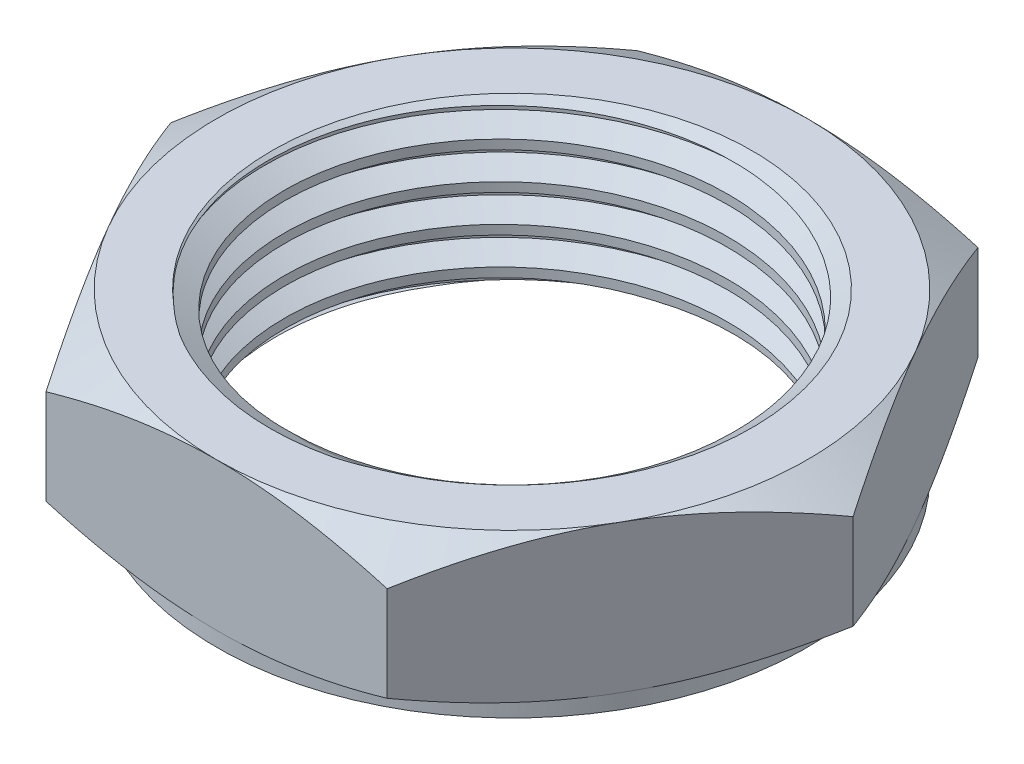
from build123d import *
from OCP.BRepFilletAPI import BRepFilletAPI_MakeChamfer
from build123d.topology import SkipClean

# Parameters (mm, degrees)
SKETCH1_R               = 12
BOSS_EXTRUDE1_DEPTH     = 4
SKETCH2_OUTSIDE_W       = 141.404
SKETCH2_OUTSIDE_H       = 136.454
SKETCH2_OUTSIDE_R       = 16
CUT_EXTRUDE1_DEPTH      = 26.716402029
CUT_EXTRUDE1_DRAFT      = -60
MIRROR1_COPY_1_SKETCH_W = 141.404
MIRROR1_COPY_1_SKETCH_H = 136.454
MIRROR1_COPY_1_SKETCH_R = 16
MIRROR1_COPY_1_DEPTH    = 26.716402029
MIRROR1_COPY_1_DRAFT    = -60
BOSS_EXTRUDE2_START     = 0.8
SKETCH7_R               = 16
SKETCH7_R_2             = 12
BOSS_EXTRUDE2_DEPTH     = 0.8
CHAMFER1_SIZE           = 1
CHAMFER1_SIZE2          = 0.700207538
THREAD_M24_2_PITCH      = 2


with BuildPart() as part:
    # Sketch1 → Boss-Extrude1 (new, symmetric)
    with BuildSketch(Plane(origin=(0, 0, 0), x_dir=(1, 0, 0), z_dir=(0, 1, 0))):
        Polygon((18.475208614, 0), (9.237604307, 16), (-9.237604307, 16), (-18.475208614, 0), (-9.237604307, -16), (9.237604307, -16), align=None)
        with Locations(Location((0, 0, 0), (0, 0, 270))):
            Circle(SKETCH1_R, mode=Mode.SUBTRACT)
    extrude(amount=BOSS_EXTRUDE1_DEPTH, both=True)


with BuildPart() as cut_extrude1_tool:
    # Sketch2 outside → Cut-Extrude1 (with draft: the straight prism first)
    with BuildSketch(Plane(origin=(0, 4, 0), x_dir=(1, 0, 0), z_dir=(0, 1, 0))):
        Rectangle(SKETCH2_OUTSIDE_W, SKETCH2_OUTSIDE_H)
        Circle(SKETCH2_OUTSIDE_R, mode=Mode.SUBTRACT)
    extrude(amount=-CUT_EXTRUDE1_DEPTH)
    # Cut-Extrude1: the draft: its side faces are tilted about the plane it starts from
    cut_extrude1_sides = [cut_extrude1_tool.faces().sort_by_distance(p)[0] for p in [
        (0, -9.358201015, 68.227),
        (70.702, -9.358201015, 0),
        (0, -9.358201015, -68.227),
        (-70.702, -9.358201015, 0),
        (-16, -9.358201015, 0),
    ]]
    draft(cut_extrude1_sides, Plane(origin=(0, 4, 0), x_dir=(1, 0, 0), z_dir=(0, 1, 0)), CUT_EXTRUDE1_DRAFT)


with BuildPart() as part_1:
    add(part.part)

    # Cut-Extrude1: cut by cut_extrude1_tool
    add(cut_extrude1_tool.part, mode=Mode.SUBTRACT)


with BuildPart() as mirror1_copy_1_tool:
    # Mirror1 copy 1 sketch → Mirror1 copy 1 (with draft: the straight prism first)
    with BuildSketch(Plane.XZ.offset(4)):
        Rectangle(MIRROR1_COPY_1_SKETCH_W, MIRROR1_COPY_1_SKETCH_H)
        Circle(MIRROR1_COPY_1_SKETCH_R, mode=Mode.SUBTRACT)
    extrude(amount=-MIRROR1_COPY_1_DEPTH)
    # Mirror1 copy 1: the draft: its side faces are tilted about the plane it starts from
    mirror1_copy_1_sides = [mirror1_copy_1_tool.faces().sort_by_distance(p)[0] for p in [
        (0, 9.358201015, 68.227),
        (70.702, 9.358201015, 0),
        (0, 9.358201015, -68.227),
        (-70.702, 9.358201015, 0),
        (-16, 9.358201015, 0),
    ]]
    draft(mirror1_copy_1_sides, Plane.XZ.offset(4), MIRROR1_COPY_1_DRAFT)


with BuildPart() as part_2:
    add(part_1.part)

    # Mirror1 copy 1: cut by mirror1_copy_1_tool
    add(mirror1_copy_1_tool.part, mode=Mode.SUBTRACT)

    # Sketch7 → Boss-Extrude2 (add)
    with SkipClean():  # the faces are left unmerged after this step: merging them gives an invalid solid
        with BuildSketch(Plane.XZ.offset(4).offset(BOSS_EXTRUDE2_START)):
            with Locations(Location((0, 0, 0), (0, 0, 270))):
                Circle(SKETCH7_R)
            with Locations(Location((0, 0, 0), (0, 0, 270))):
                Circle(SKETCH7_R_2, mode=Mode.SUBTRACT)
        extrude(amount=-BOSS_EXTRUDE2_DEPTH)

    # Chamfer1: one chamfer whose edges measure the first distance from different faces: ONE call of the kernel's chamfer builder (chamfer() names one face for all edges)
    chamfer1_edges_1 = [part_2.edges().sort_by_distance(p)[0] for p in [
        (0, -4.8, 12),
    ]]
    chamfer1_side_1 = [part_2.faces().sort_by_distance(p)[0] for p in [
        (0, -4.8, 15.54745166),
    ]]
    chamfer1_edges_2 = [part_2.edges().sort_by_distance(p)[0] for p in [
        (0, 4, -12),
    ]]
    chamfer1_side_2 = [part_2.faces().sort_by_distance(p)[0] for p in [
        (15.54745166, 4, -4.1e-08),
    ]]
    chamfer1 = BRepFilletAPI_MakeChamfer(part_2.part.solid().wrapped)
    for e in chamfer1_edges_1:
        chamfer1.Add(CHAMFER1_SIZE, CHAMFER1_SIZE2, e.wrapped, chamfer1_side_1[0].wrapped)  # the first distance lies on this face
    for e in chamfer1_edges_2:
        chamfer1.Add(CHAMFER1_SIZE, CHAMFER1_SIZE2, e.wrapped, chamfer1_side_2[0].wrapped)  # the first distance lies on this face
    add(Compound.cast(chamfer1.Shape()), mode=Mode.REPLACE)

    # M24*2: arcs per turn and ends read off the stored shape
    # M24*2: the profile of Thread Profile10 profile screwed along a right-hand helix through 6.699792 turns, 10 arcs to a turn; built about Z, then put on its axis
    thread_m24_2_z = Axis((0, 0, 0), (0, 0, 1))
    thread_m24_2_corners = [(11.9997, 0, -0.000173205), (13.08253175, 0, 0.624999997), (13.08253175, 0, 0.874999997), (11.9997, 0, 1.5001732)]
    with BuildLine(mode=Mode.PRIVATE) as thread_m24_2_profile:
        Line(thread_m24_2_corners[0], thread_m24_2_corners[1])
        Line(thread_m24_2_corners[1], thread_m24_2_corners[2])
        Line(thread_m24_2_corners[2], thread_m24_2_corners[3])
        Line(thread_m24_2_corners[3], thread_m24_2_corners[0])
    thread_m24_2_cap = Face(thread_m24_2_profile.wire())
    thread_m24_2_turn_angles = [0, 18, 36, 54, 72, 90, 108, 126, 144, 162, 180, 198, 216, 234, 252, 270, 288, 306, 324, 342, 360]
    thread_m24_2_turn_weights = [1, 0.9510565162951535, 1, 0.9510565162951535, 1, 0.9510565162951535, 1, 0.9510565162951535, 1, 0.9510565162951535, 1, 0.9510565162951535, 1, 0.9510565162951535, 1, 0.9510565162951535, 1, 0.9510565162951535, 1, 0.9510565162951535, 1]
    thread_m24_2_turn_rails = [Edge.make_bspline([Vector(p[0], p[1], 0).rotate(thread_m24_2_z, thread_m24_2_turn_angles[k]) / thread_m24_2_turn_weights[k] + Vector(0, 0, p[2] + THREAD_M24_2_PITCH * thread_m24_2_turn_angles[k] / 360) for k in range(21)], [0, 0, 0, 1, 1, 2, 2, 3, 3, 4, 4, 5, 5, 6, 6, 7, 7, 8, 8, 9, 9, 10, 10, 10], 2, thread_m24_2_turn_weights) for p in thread_m24_2_corners]
    thread_m24_2_turn_sides = [Face.make_surface_from_curves(thread_m24_2_turn_rails[p[0]], thread_m24_2_turn_rails[p[1]]) for p in [(0, 1), (1, 2), (2, 3), (3, 0)]]
    thread_m24_2_last_angles = [2160, 2178, 2196, 2214, 2232, 2250, 2268, 2286, 2304, 2322, 2340, 2358, 2376, 2393.9625, 2411.925]
    thread_m24_2_last_weights = [1, 0.9510565162951535, 1, 0.9510565162951535, 1, 0.9510565162951535, 1, 0.9510565162951535, 1, 0.9510565162951535, 1, 0.9510565162951535, 1, 0.9512585637293818, 1]
    thread_m24_2_last_rails = [Edge.make_bspline([Vector(p[0], p[1], 0).rotate(thread_m24_2_z, thread_m24_2_last_angles[k]) / thread_m24_2_last_weights[k] + Vector(0, 0, p[2] + THREAD_M24_2_PITCH * thread_m24_2_last_angles[k] / 360) for k in range(15)], [0, 0, 0, 1, 1, 2, 2, 3, 3, 4, 4, 5, 5, 6, 6, 7, 7, 7], 2, thread_m24_2_last_weights) for p in thread_m24_2_corners]
    thread_m24_2_last_sides = [Face.make_surface_from_curves(thread_m24_2_last_rails[p[0]], thread_m24_2_last_rails[p[1]]) for p in [(0, 1), (1, 2), (2, 3), (3, 0)]]
    thread_m24_2 = Plane(origin=(0, 6.299792462, 0), x_dir=(-1, 0, 0), z_dir=(0, -1, 0)) * Solid(Shell([*[p.moved(Location((0, 0, THREAD_M24_2_PITCH * i))) for i in range(6) for p in thread_m24_2_turn_sides], *thread_m24_2_last_sides, thread_m24_2_cap, thread_m24_2_cap.rotate(thread_m24_2_z, 2411.925).moved(Location((0, 0, THREAD_M24_2_PITCH * 2411.925 / 360)))]))
    add(thread_m24_2, mode=Mode.SUBTRACT)


solid = part_2.part
